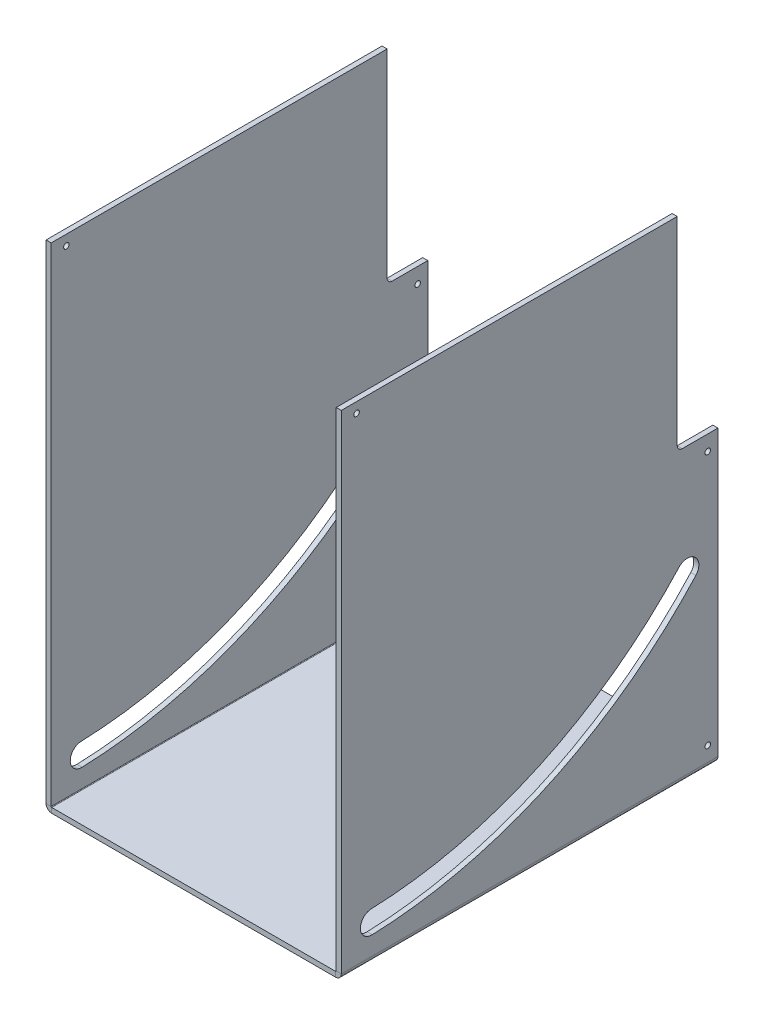
from build123d import *

# Parameters (mm, degrees)
SKETCH1_W                    = 368.3
SKETCH1_H                    = 469.9
BASE_FLANGE1_DEPTH           = 6.35
EDGE_FLANGE1_STRIP_W         = 26.8732
EDGE_FLANGE1_STRIP_H         = 6.35
EDGE_FLANGE1_STRIP_CUT_DEPTH = 469.9
EDGE_FLANGE1_DEPTH           = 469.9
EDGE_FLANGE2_STRIP_W         = 26.8732
EDGE_FLANGE2_STRIP_H         = 6.35
EDGE_FLANGE2_STRIP_CUT_DEPTH = 469.9
EDGE_FLANGE2_DEPTH           = 469.9
SKETCH14_R                   = 3.429
SKETCH14_W                   = 50.8
SKETCH14_H                   = 254
CUT_EXTRUDE1_DEPTH           = 858.814258741
FILLET1_R                    = 6.35
CUT_EXTRUDE2_DEPTH           = 858.814258741


# Sheet-metal steps are written as plain solids
with BuildPart() as part:
    # Sketch1 → Base-Flange1 (new body)
    with BuildSketch(Plane(origin=(0, 0, 0), x_dir=(1, 0, 0), z_dir=(0, 1, 0))):
        with Locations((184.15, 234.95)):
            Rectangle(SKETCH1_W, SKETCH1_H)
    extrude(amount=BASE_FLANGE1_DEPTH)

    # Edge-Flange1 strip (across the edge) → Edge-Flange1 strip cut (cut)
    with BuildSketch(Plane(origin=(368.3, 6.35, 0), x_dir=(-1, 0, 0), z_dir=(0, 0, -1))):
        with Locations((-6.35, -3.175)):
            Rectangle(EDGE_FLANGE1_STRIP_W, EDGE_FLANGE1_STRIP_H)
    extrude(amount=EDGE_FLANGE1_STRIP_CUT_DEPTH, mode=Mode.SUBTRACT)

    # Edge-Flange1 section (across the edge) → Edge-Flange1 (add)
    with BuildSketch(Plane(origin=(368.3, 6.35, 0), x_dir=(-1, 0, 0), z_dir=(0, 0, -1))):
        with BuildLine():
            Line((0, 0.7366), (0, 609.6))
            Line((0, 609.6), (6.35, 609.6))
            Line((6.35, 609.6), (6.35, 0.7366))
            ThreePointArc((6.35, 0.7366), (6.565745145, 0.215745145), (7.0866, 0))
            Line((7.0866, 0), (7.0866, -6.35))
            ThreePointArc((7.0866, -6.35), (2.075617084, -4.274382916), (0, 0.7366))
        make_face()
    extrude(amount=EDGE_FLANGE1_DEPTH)

    # Edge-Flange2 strip (across the edge) → Edge-Flange2 strip cut (cut)
    with BuildSketch(Plane(origin=(0, 6.35, -469.9), x_dir=(1, 0, 0), z_dir=(0, 0, 1))):
        with Locations((-6.35, -3.175)):
            Rectangle(EDGE_FLANGE2_STRIP_W, EDGE_FLANGE2_STRIP_H)
    extrude(amount=EDGE_FLANGE2_STRIP_CUT_DEPTH, mode=Mode.SUBTRACT)

    # Edge-Flange2 section (across the edge) → Edge-Flange2 (add)
    with BuildSketch(Plane(origin=(0, 6.35, -469.9), x_dir=(1, 0, 0), z_dir=(0, 0, 1))):
        with BuildLine():
            Line((0, 0.7366), (0, 609.6))
            Line((0, 609.6), (6.35, 609.6))
            Line((6.35, 609.6), (6.35, 0.7366))
            ThreePointArc((6.35, 0.7366), (6.565745145, 0.215745145), (7.0866, 0))
            Line((7.0866, 0), (7.0866, -6.35))
            ThreePointArc((7.0866, -6.35), (2.075617084, -4.274382916), (0, 0.7366))
        make_face()
    extrude(amount=EDGE_FLANGE2_DEPTH)

    # Sketch14 → Cut-Extrude1 (cut, through all)
    with BuildSketch(Plane.ZY):
        with Locations(Location((-19.05, 603.25, 0), (0, 0, 270))):
            Circle(SKETCH14_R)
        with Locations(Location((-457.2, 342.9, 0), (0, 0, 270))):
            Circle(SKETCH14_R)
        with Locations(Location((-457.2, 25.4, 0), (0, 0, 270))):
            Circle(SKETCH14_R)
        with Locations((-444.5, 488.95)):
            Rectangle(SKETCH14_W, SKETCH14_H)
    extrude(amount=-CUT_EXTRUDE1_DEPTH, mode=Mode.SUBTRACT)

    # Fillet1
    fillet1_edges = [part.edges().sort_by_distance(p)[0] for p in [
        (365.125, 361.95, -419.1),
        (3.175, 361.95, -419.1),
    ]]
    fillet(fillet1_edges, radius=FILLET1_R)

    # Sketch15 → Cut-Extrude2 (cut, through all)
    with BuildSketch(Plane.ZY):
        with BuildLine():
            ThreePointArc((-421.252860066, 235.717214458), (-247.287179467, 108.52252047), (-37.613208926, 58.729204834))
            ThreePointArc((-37.613208926, 58.729204834), (-23.820795166, 43.963208926), (-38.586791074, 30.170795166))
            ThreePointArc((-38.586791074, 30.170795166), (-259.257504441, 82.575614199), (-442.347139934, 216.441271373))
            ThreePointArc((-442.347139934, 216.441271373), (-441.437971542, 236.62638285), (-421.252860066, 235.717214458))
        make_face()
    extrude(amount=-CUT_EXTRUDE2_DEPTH, mode=Mode.SUBTRACT)


solid = part.part
